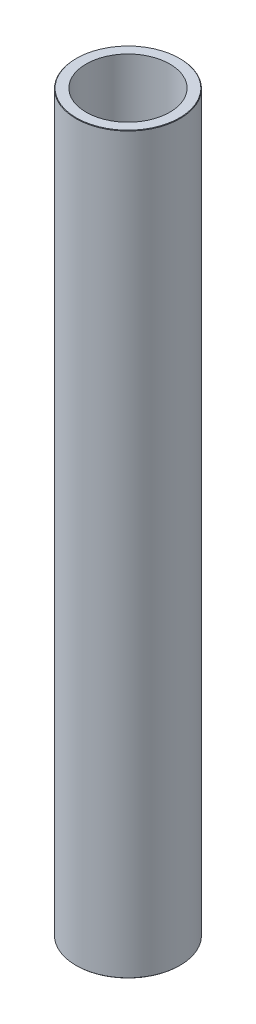
from build123d import *
from OCP.BRepFilletAPI import BRepFilletAPI_MakeChamfer

# Parameters (mm, degrees)
SKETCH1_R           = 42.5
BOSS_EXTRUDE1_DEPTH = 600
SKETCH2_R           = 34.185074691
CUT_EXTRUDE1_DEPTH  = 604.002902149
CHAMFER1_SIZE       = 0.364966992
CHAMFER1_SIZE2      = 0.360566705


with BuildPart() as part:
    # Sketch1 → Boss-Extrude1 (new body)
    with BuildSketch(Plane(origin=(0, 0, 0), x_dir=(1, 0, 0), z_dir=(0, 1, 0))):
        Circle(SKETCH1_R)
    extrude(amount=BOSS_EXTRUDE1_DEPTH)

    # Sketch2 → Cut-Extrude1 (cut, through all)
    with BuildSketch(Plane(origin=(0, 0, 0), x_dir=(1, 0, 0), z_dir=(0, 1, 0))):
        Circle(SKETCH2_R)
    extrude(amount=CUT_EXTRUDE1_DEPTH, mode=Mode.SUBTRACT)

    # Chamfer1: one chamfer whose edges measure the first distance from different faces: ONE call of the kernel's chamfer builder (chamfer() names one face for all edges)
    chamfer1_edges_1 = [part.edges().sort_by_distance(p)[0] for p in [
        (-42.5, 600, 0),
    ]]
    chamfer1_side_1 = [part.faces().sort_by_distance(p)[0] for p in [
        (-42.5, 300, 0),
    ]]
    chamfer1_edges_2 = [part.edges().sort_by_distance(p)[0] for p in [
        (-42.5, 0, 0),
    ]]
    chamfer1_side_2 = [part.faces().sort_by_distance(p)[0] for p in [
        (-41.297918472, 0, 0),
    ]]
    chamfer1 = BRepFilletAPI_MakeChamfer(part.part.solid().wrapped)
    for e in chamfer1_edges_1:
        chamfer1.Add(CHAMFER1_SIZE, CHAMFER1_SIZE2, e.wrapped, chamfer1_side_1[0].wrapped)  # the first distance lies on this face
    for e in chamfer1_edges_2:
        chamfer1.Add(CHAMFER1_SIZE, CHAMFER1_SIZE2, e.wrapped, chamfer1_side_2[0].wrapped)  # the first distance lies on this face
    add(Compound.cast(chamfer1.Shape()), mode=Mode.REPLACE)


solid = part.part
